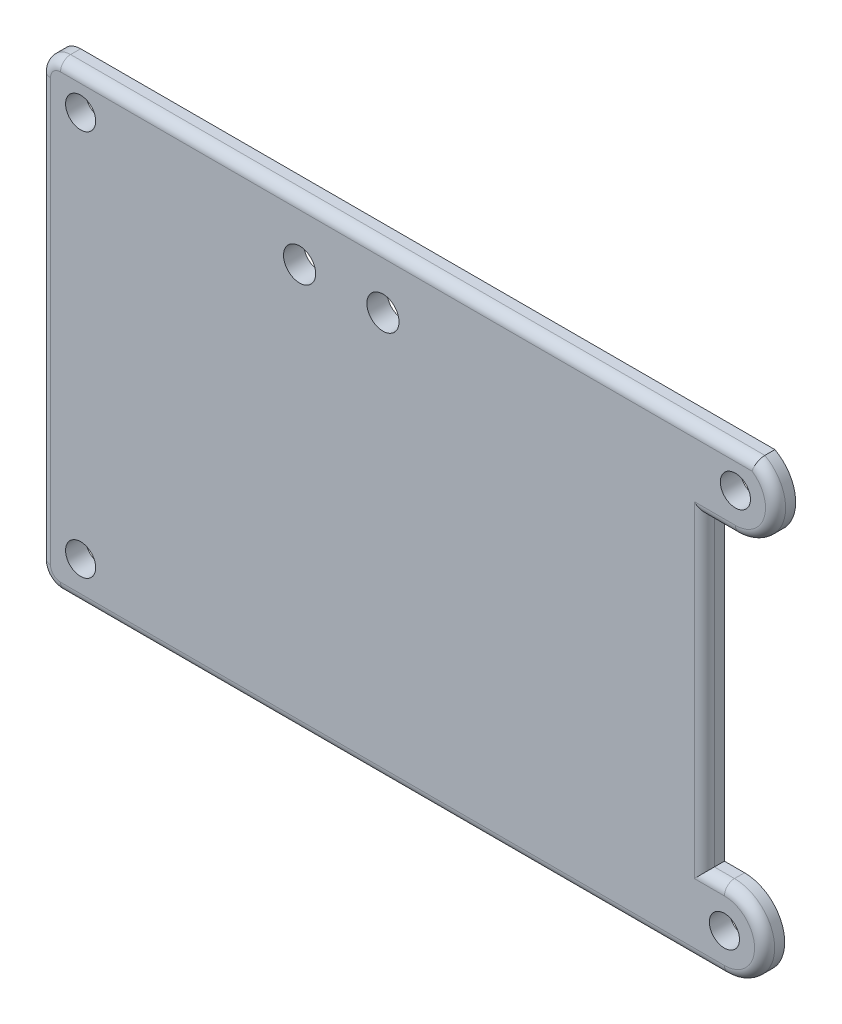
from build123d import *

# Parameters (mm, degrees)
SKETCH_2_R      = 1.5
SKETCH_2_R_2    = 1.6
EXTRUDE_1_DEPTH = 2
SKETCH_2_6_W    = 15
SKETCH_2_6_H    = 2
SKETCH_2_6_W_2  = 2
SKETCH_2_6_H_2  = 20.554974884
EXTRUDE_2_DEPTH = 1
FILLET_1_R      = 1


with BuildPart() as part:
    # 草图2 → 凸台-拉伸1 (new body)
    with BuildSketch(Plane.XY):
        with BuildLine():
            ThreePointArc((-10.601500464, -1), (-10.015714027, -2.414213562), (-8.601500464, -3))
            Line((-8.601500464, -3), (57.5, -3))
            ThreePointArc((57.5, -3), (61.5, 1), (57.5, 5))
            Line((57.5, 5), (55.5, 5))
            Line((55.5, 5), (55.5, 35.50095784))
            Line((55.5, 35.50095784), (58.590729836, 35.50095784))
            ThreePointArc((58.590729836, 35.50095784), (62.463713182, 38.50095784), (60.527221509, 43.00095784))
            Line((60.527221509, 43.00095784), (-8.601500464, 43.00095784))
            ThreePointArc((-8.601500464, 43.00095784), (-10.015714027, 42.415171403), (-10.601500464, 41.00095784))
            Line((-10.601500464, 41.00095784), (-10.601500464, -1))
        make_face()
        with Locations((-6.601500464, 1)):
            Circle(SKETCH_2_R, mode=Mode.SUBTRACT)
        with Locations((57.5, 1)):
            Circle(SKETCH_2_R, mode=Mode.SUBTRACT)
        with Locations((-6.601500464, 39.50095784)):
            Circle(SKETCH_2_R, mode=Mode.SUBTRACT)
        with Locations((15.2, 37.3)):
            Circle(SKETCH_2_R_2, mode=Mode.SUBTRACT)
        with Locations((23.5, 37.3)):
            Circle(SKETCH_2_R_2, mode=Mode.SUBTRACT)
        with Locations((58.590729836, 39.50095784)):
            Circle(SKETCH_2_R, mode=Mode.SUBTRACT)
    extrude(amount=EXTRUDE_1_DEPTH)

    # 草图2<6> → 凸台-拉伸2 (add)
    with BuildSketch(Plane.XY):
        with Locations((9.5, 40.50095784)):
            Rectangle(SKETCH_2_6_W, SKETCH_2_6_H)
        with Locations((-7.601500464, 22)):
            Rectangle(SKETCH_2_6_W_2, SKETCH_2_6_H_2)
        with Locations((43, 40.50095784)):
            Rectangle(SKETCH_2_6_W, SKETCH_2_6_H)
        with Locations((9.5, 0)):
            Rectangle(SKETCH_2_6_W, SKETCH_2_6_H)
        with Locations((43, 0)):
            Rectangle(SKETCH_2_6_W, SKETCH_2_6_H)
    extrude(amount=-EXTRUDE_2_DEPTH)

    # 圆角1
    # the kernel refuses this fillet: 1 mm, written as the material it takes off along each edge
    with BuildSketch(Plane(origin=(-8.601500464, -1, 2), x_dir=(-1, 0, 0), z_dir=(0, 1, 0))) as fillet_1_piece_1:
        with BuildLine():
            CenterArc((2 - FILLET_1_R, -FILLET_1_R), FILLET_1_R, 0, 90)
            Line((2 - FILLET_1_R, 0), (2, 0))
            Line((2, 0), (2, -FILLET_1_R))
        make_face()
    revolve(axis=Axis((-8.601500464, -1, 2), (0, 0, 1)), revolution_arc=90, mode=Mode.SUBTRACT)
    with BuildSketch(Plane(origin=(-8.601500464, -3, 2), x_dir=(0, 0, -1), z_dir=(1, 0, 0))) as fillet_1_piece_2:
        with BuildLine():
            CenterArc((FILLET_1_R, FILLET_1_R), FILLET_1_R, 180, 90)
            Line((0, FILLET_1_R), (0, 0))
            Line((0, 0), (FILLET_1_R, 0))
        make_face()
    extrude(amount=66.101500464, mode=Mode.SUBTRACT)
    with BuildSketch(Plane(origin=(57.5, 1, 2), x_dir=(0, -1, 0), z_dir=(-1, 0, 0))) as fillet_1_piece_3:
        with BuildLine():
            CenterArc((4 - FILLET_1_R, -FILLET_1_R), FILLET_1_R, 0, 90)
            Line((4, -FILLET_1_R), (4, 0))
            Line((4, 0), (4 - FILLET_1_R, 0))
        make_face()
    revolve(axis=Axis((57.5, 1, 2), (0, 0, 1)), revolution_arc=180, mode=Mode.SUBTRACT)
    with BuildSketch(Plane(origin=(57.5, 5, 2), x_dir=(0, -1, 0), z_dir=(-1, 0, 0))) as fillet_1_piece_4:
        with BuildLine():
            CenterArc((FILLET_1_R, -FILLET_1_R), FILLET_1_R, 90, 90)
            Line((0, -FILLET_1_R), (0, 0))
            Line((0, 0), (FILLET_1_R, 0))
        make_face()
    extrude(amount=2, mode=Mode.SUBTRACT)
    with BuildSketch(Plane(origin=(55.5, 5, 2), x_dir=(-1, 0, 0), z_dir=(0, 1, 0))) as fillet_1_piece_5:
        with BuildLine():
            CenterArc((FILLET_1_R, -FILLET_1_R), FILLET_1_R, 90, 90)
            Line((0, -FILLET_1_R), (0, 0))
            Line((0, 0), (FILLET_1_R, 0))
        make_face()
    extrude(amount=30.50095784, mode=Mode.SUBTRACT)
    with BuildSketch(Plane(origin=(55.5, 35.50095784, 2), x_dir=(0, 1, 0), z_dir=(1, 0, 0))) as fillet_1_piece_6:
        with BuildLine():
            CenterArc((FILLET_1_R, -FILLET_1_R), FILLET_1_R, 90, 90)
            Line((0, -FILLET_1_R), (0, 0))
            Line((0, 0), (FILLET_1_R, 0))
        make_face()
    extrude(amount=3.090729836, mode=Mode.SUBTRACT)
    with BuildSketch(Plane(origin=(58.590729836, 39.50095784, 2), x_dir=(0, -1, 0), z_dir=(-1, 0, 0))) as fillet_1_piece_7:
        with BuildLine():
            CenterArc((4 - FILLET_1_R, -FILLET_1_R), FILLET_1_R, 0, 90)
            Line((4, -FILLET_1_R), (4, 0))
            Line((4, 0), (4 - FILLET_1_R, 0))
        make_face()
    revolve(axis=Axis((58.590729836, 39.50095784, 2), (0, 0, 1)), revolution_arc=186.895375862, mode=Mode.SUBTRACT)
    with BuildSketch(Plane(origin=(63.027221509, 43.00095784, 2), x_dir=(0, -1, 0), z_dir=(-1, 0, 0))) as fillet_1_piece_8:
        with BuildLine():
            CenterArc((FILLET_1_R, -FILLET_1_R), FILLET_1_R, 90, 90)
            Line((0, -FILLET_1_R), (0, 0))
            Line((0, 0), (FILLET_1_R, 0))
        make_face()
    extrude(amount=71.628721973, mode=Mode.SUBTRACT)
    with BuildSketch(Plane(origin=(-8.601500464, 41.00095784, 2), x_dir=(0, 1, 0), z_dir=(1, 0, 0))) as fillet_1_piece_9:
        with BuildLine():
            CenterArc((2 - FILLET_1_R, -FILLET_1_R), FILLET_1_R, 0, 90)
            Line((2, -FILLET_1_R), (2, 0))
            Line((2, 0), (2 - FILLET_1_R, 0))
        make_face()
    revolve(axis=Axis((-8.601500464, 41.00095784, 2), (0, 0, 1)), revolution_arc=90, mode=Mode.SUBTRACT)
    with BuildSketch(Plane(origin=(-10.601500464, 41.00095784, 2), x_dir=(0, 0, -1), z_dir=(0, -1, 0))) as fillet_1_piece_10:
        with BuildLine():
            CenterArc((FILLET_1_R, FILLET_1_R), FILLET_1_R, 180, 90)
            Line((0, FILLET_1_R), (0, 0))
            Line((0, 0), (FILLET_1_R, 0))
        make_face()
    extrude(amount=42.00095784, mode=Mode.SUBTRACT)
    with BuildSketch(Plane(origin=(57.5, 5, 2), x_dir=(0, -1, 0), z_dir=(-1, 0, 0))) as fillet_1_piece_11a_section:
        with BuildLine():
            CenterArc((FILLET_1_R, -FILLET_1_R), FILLET_1_R, 90, 90)
            Line((0, -FILLET_1_R), (0, 0))
            Line((0, 0), (FILLET_1_R, 0))
        make_face()
    fillet_1_piece_11a = extrude(amount=4.5, mode=Mode.PRIVATE)
    fillet_1_piece_11a = split(fillet_1_piece_11a, bisect_by=Plane(origin=(55.5, 4.773604886, 1.773604886), z_dir=(-1, 0, 0)), keep=Keep.TOP, mode=Mode.PRIVATE)
    with BuildSketch(Plane(origin=(55.5, 2.5, 2), x_dir=(-1, 0, 0), z_dir=(0, 1, 0))) as fillet_1_piece_11b_section:
        with BuildLine():
            CenterArc((FILLET_1_R, -FILLET_1_R), FILLET_1_R, 90, 90)
            Line((0, -FILLET_1_R), (0, 0))
            Line((0, 0), (FILLET_1_R, 0))
        make_face()
    fillet_1_piece_11b = extrude(amount=33.00095784, mode=Mode.PRIVATE)
    fillet_1_piece_11b = split(fillet_1_piece_11b, bisect_by=Plane(origin=(55.273604886, 5, 1.773604886), z_dir=(0, -1, 0)), keep=Keep.TOP, mode=Mode.PRIVATE)
    fillet_1_piece_11 = fillet_1_piece_11a & fillet_1_piece_11b
    add(fillet_1_piece_11, mode=Mode.SUBTRACT)
    with BuildSketch(Plane(origin=(55.5, 5, 2), x_dir=(-1, 0, 0), z_dir=(0, 1, 0))) as fillet_1_piece_12a_section:
        with BuildLine():
            CenterArc((FILLET_1_R, -FILLET_1_R), FILLET_1_R, 90, 90)
            Line((0, -FILLET_1_R), (0, 0))
            Line((0, 0), (FILLET_1_R, 0))
        make_face()
    fillet_1_piece_12a = extrude(amount=33.00095784, mode=Mode.PRIVATE)
    fillet_1_piece_12a = split(fillet_1_piece_12a, bisect_by=Plane(origin=(55.273604886, 35.50095784, 1.773604886), z_dir=(0, 1, 0)), keep=Keep.TOP, mode=Mode.PRIVATE)
    with BuildSketch(Plane(origin=(53, 35.50095784, 2), x_dir=(0, 1, 0), z_dir=(1, 0, 0))) as fillet_1_piece_12b_section:
        with BuildLine():
            CenterArc((FILLET_1_R, -FILLET_1_R), FILLET_1_R, 90, 90)
            Line((0, -FILLET_1_R), (0, 0))
            Line((0, 0), (FILLET_1_R, 0))
        make_face()
    fillet_1_piece_12b = extrude(amount=5.590729836, mode=Mode.PRIVATE)
    fillet_1_piece_12b = split(fillet_1_piece_12b, bisect_by=Plane(origin=(55.5, 35.727352955, 1.773604886), z_dir=(-1, 0, 0)), keep=Keep.TOP, mode=Mode.PRIVATE)
    fillet_1_piece_12 = fillet_1_piece_12a & fillet_1_piece_12b
    add(fillet_1_piece_12, mode=Mode.SUBTRACT)


solid = part.part
